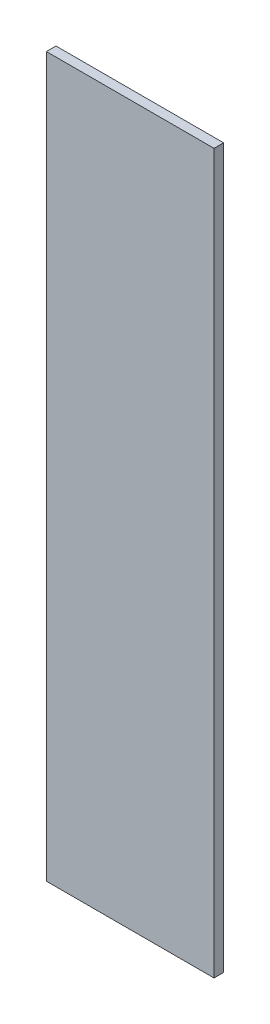
from build123d import *

# Parameters (mm, degrees)
SKETCH1_W           = 28
SKETCH1_H           = 120
BOSS_EXTRUDE1_DEPTH = 1.6


with BuildPart() as part:
    # Sketch1 → Boss-Extrude1 (new body)
    with BuildSketch(Plane.XY):
        with Locations((0, 60)):
            Rectangle(SKETCH1_W, SKETCH1_H)
    extrude(amount=BOSS_EXTRUDE1_DEPTH)


solid = part.part
